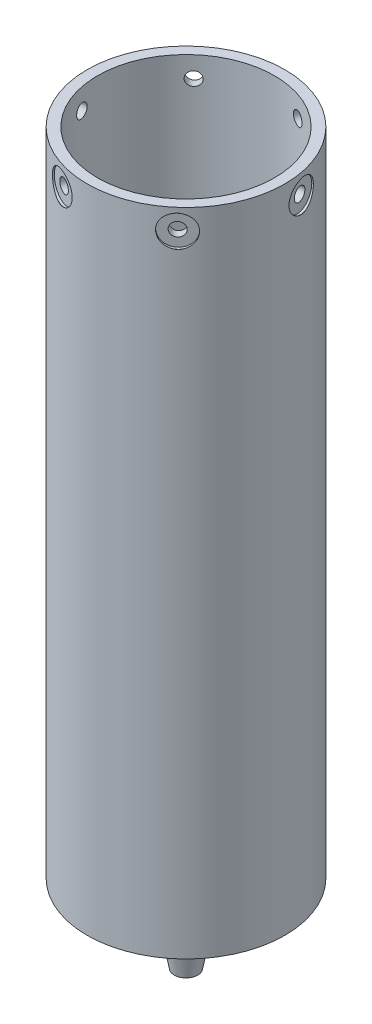
from build123d import *

# Parameters (mm, degrees)
SKETCH_1_R               = 19
EXTRUDE_1_DEPTH          = 125
SKETCH_2_R               = 17
CUT_EXTRUDE_1_DEPTH      = 124
SKETCH_4_R               = 1.875
CUT_EXTRUDE_2_DEPTH      = 124
PATTERN_CIRCULAR_2_COUNT = 6


# Read off the part's stored shape, not the designer's step: M2 六角头螺栓的柱形沉头孔2
with BuildPart() as part:
    # 草图1 → 凸台-拉伸1 (new body)
    with BuildSketch(Plane(origin=(0, 0, 0), x_dir=(1, 0, 0), z_dir=(0, 1, 0))):
        with Locations(Location((0, 0, 0), (0, 0, 270))):
            Circle(SKETCH_1_R)
    extrude(amount=EXTRUDE_1_DEPTH)

    # 草图2 → 切除-拉伸1 (cut)
    with BuildSketch(Plane(origin=(0, 125, 0), x_dir=(1, 0, 0), z_dir=(0, 1, 0))):
        with Locations(Location((0, 0, 0), (0, 0, 270))):
            Circle(SKETCH_2_R)
    extrude(amount=-CUT_EXTRUDE_1_DEPTH, mode=Mode.SUBTRACT)

    # 草图3 → 旋转1 (revolve)
    with BuildSketch(Plane(origin=(0, 0, 0), x_dir=(0, 0, -1), z_dir=(1, 0, 0)), mode=Mode.PRIVATE) as revolve_1_sk:
        Polygon((5, 0), (2.25, -15), (0, -15), (0, 0), align=None)
    revolve(revolve_1_sk.sketch.rotate(Axis((0, 0, 0), (0, -1, 0)), 180), axis=Axis((0, 0, 0), (0, -1, 0)))

    # 草图4 → 切除-拉伸2 (cut)
    with BuildSketch(Plane.XZ.offset(15)):
        with Locations(Location((0, 0, 0), (0, 0, 270))):
            Circle(SKETCH_4_R)
    extrude(amount=-CUT_EXTRUDE_2_DEPTH, mode=Mode.SUBTRACT)

    # M2 六角头螺栓的柱形沉头孔2 outline → M2 六角头螺栓的柱形沉头孔2 (revolve, cut)
    with BuildSketch(Plane(origin=(0, 121.014872687, 0), x_dir=(0, 1, 0), z_dir=(-0.19922331776185506, 0, -0.9799541160992993))):
        Polygon((3, -18.975), (3, -18.5), (1.3, -18.5), (1.3, -19.000066038), (3, -19.000066038), align=None)
        Polygon((3.025066038, -19.000066038), (2.999995833, -18.974995833), (3, -19.000066038), align=None)
        Polygon((1.3, -19.000066038), (1.3, -18.5), (1.3, -16.950194399), (0, -16.950194399), (0, -19.000066038), align=None)
    hole_wizard_m2_2 = revolve(axis=Axis((0, 121.014872687, 0), (0.9799541160992993, 0, -0.19922331776185506)), mode=Mode.SUBTRACT)

    # 阵列(圆周)2: M2 六角头螺栓的柱形沉头孔2 ×6 about axis
    pattern_circular_2_axis = Axis((0, 0, 0), (0, 1, 0))
    for i in range(1, PATTERN_CIRCULAR_2_COUNT):
        add(hole_wizard_m2_2.rotate(pattern_circular_2_axis, i * 360 / PATTERN_CIRCULAR_2_COUNT), mode=Mode.SUBTRACT)


solid = part.part
